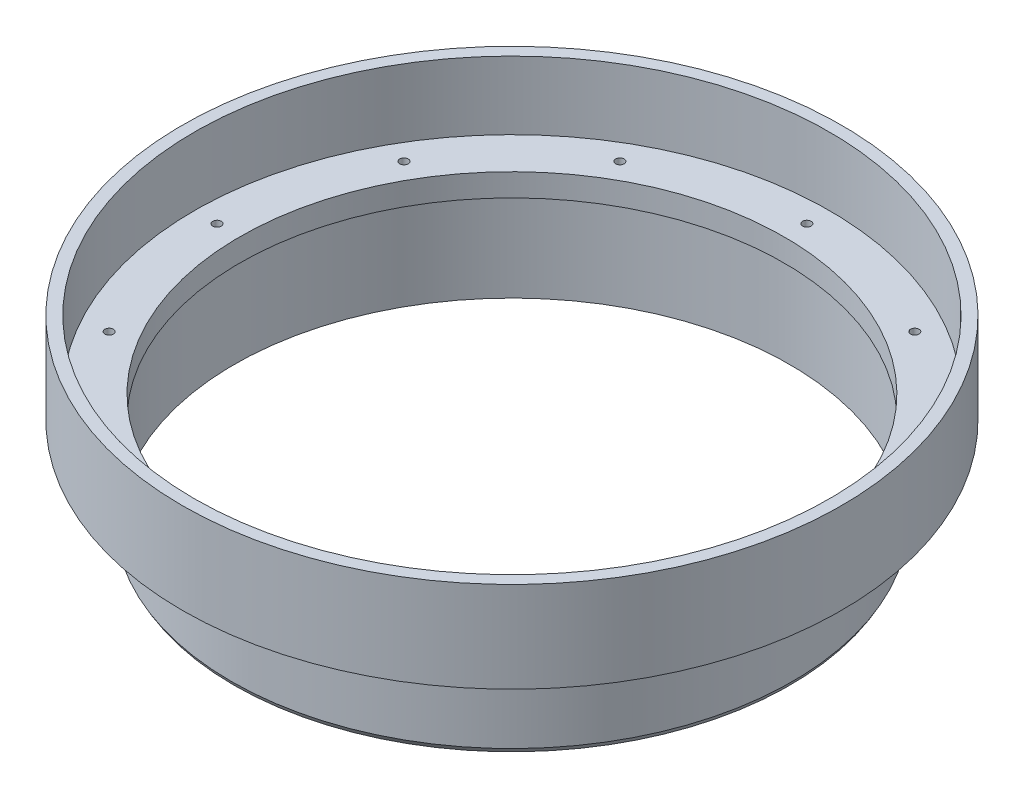
from build123d import *

# Parameters (mm, degrees)
SCREW_HOLES_COUNT = 12


with BuildPart() as part:
    # Cross Section → Main (revolve)
    with BuildSketch(Plane.XY):
        Polygon((-38.1, 0), (-38.1, -3.175), (-38.8874, -3.175), (-38.8874, -15.875), (-39.2684, -15.215088642), (-39.2684, -3.175), (-46.1264, -3.175), (-46.1264, 9.525), (-44.45, 9.525), (-44.45, 0), align=None)
    revolve(axis=Axis((0, 55, 0), (0, -1, 0)))

    # Sketch7 → #0-80 Tapped Hole1 (revolve, cut)
    with BuildSketch(Plane(origin=(-41.275, 0, 0), x_dir=(0, 0, 1), z_dir=(1, 0, 0))):
        Polygon((0, 0), (0, 3.532890611), (0.59563, 3.175), (0.59563, 0), align=None)
    f_0_80_tapped_hole1 = revolve(axis=Axis((-41.275, 6.35, 0), (0, -1, 0)), mode=Mode.SUBTRACT)

    # Screw Holes: #0-80 Tapped Hole1 ×12 about axis
    screw_holes_axis = Axis((0, 55, 0), (0, -1, 0))
    for i in range(1, SCREW_HOLES_COUNT):
        add(f_0_80_tapped_hole1.rotate(screw_holes_axis, i * 360 / SCREW_HOLES_COUNT), mode=Mode.SUBTRACT)


solid = part.part
